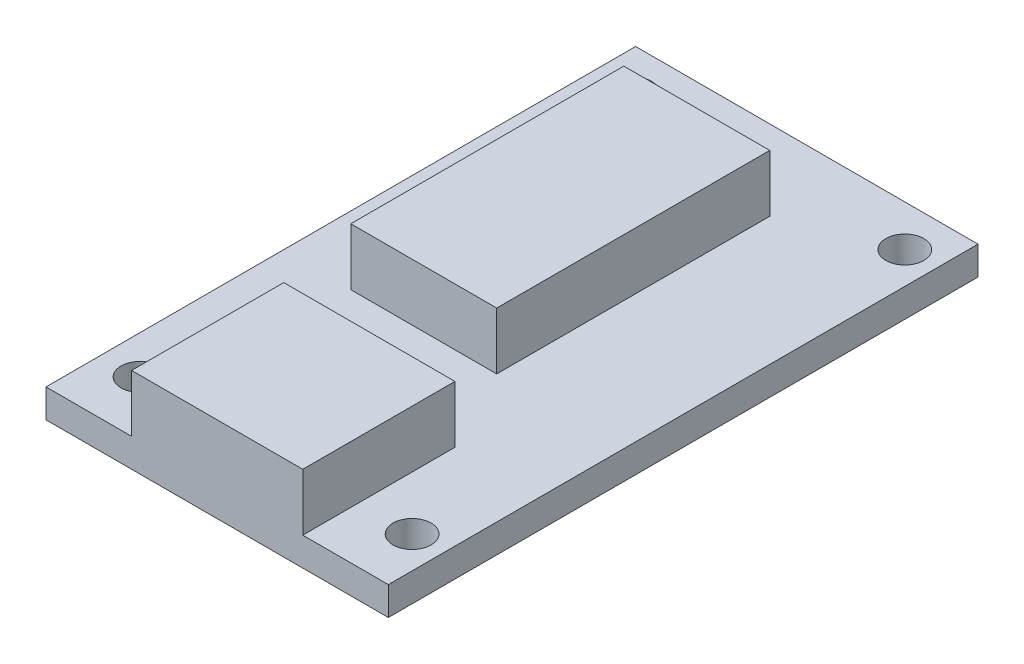
from build123d import *

# Parameters (mm, degrees)
SKETCH1_W           = 18
SKETCH1_H           = 31
BOSS_EXTRUDE1_DEPTH = 1.5
SKETCH1_3_W         = 9
SKETCH1_3_H         = 8
BOSS_EXTRUDE2_DEPTH = 4.5
SKETCH2_W           = 7.673510846
SKETCH2_H           = 14.355500628
BOSS_EXTRUDE3_DEPTH = 3
SKETCH3_R           = 1
CUT_EXTRUDE1_DEPTH  = 10


with BuildPart() as part:
    # Sketch1 → Boss-Extrude1 (new body)
    with BuildSketch(Plane(origin=(0, 0, 0), x_dir=(1, 0, 0), z_dir=(0, 1, 0))):
        with Locations((9, 15.5)):
            Rectangle(SKETCH1_W, SKETCH1_H)
    extrude(amount=BOSS_EXTRUDE1_DEPTH)

    # Sketch1<3> → Boss-Extrude2 (add)
    with BuildSketch(Plane(origin=(0, 0, 0), x_dir=(1, 0, 0), z_dir=(0, 1, 0))):
        with Locations((9, 4)):
            Rectangle(SKETCH1_3_W, SKETCH1_3_H)
    extrude(amount=BOSS_EXTRUDE2_DEPTH)

    # Sketch2 → Boss-Extrude3 (add)
    with BuildSketch(Plane(origin=(0, 1.5, 0), x_dir=(1, 0, 0), z_dir=(0, 1, 0))):
        with Locations((7.420466752, 19.616967898)):
            Rectangle(SKETCH2_W, SKETCH2_H)
    extrude(amount=BOSS_EXTRUDE3_DEPTH)

    # Sketch3 → Cut-Extrude1 (cut)
    with BuildSketch(Plane(origin=(0, 1.5, 0), x_dir=(1, 0, 0), z_dir=(0, 1, 0))):
        with Locations((2.017303644, 28.83251993)):
            Circle(SKETCH3_R)
        with Locations((16.320228506, 28.83251993)):
            Circle(SKETCH3_R)
        with Locations((2.017303644, 2.926927408)):
            Circle(SKETCH3_R)
        with Locations((16.320228506, 2.926927408)):
            Circle(SKETCH3_R)
    extrude(amount=-CUT_EXTRUDE1_DEPTH, mode=Mode.SUBTRACT)


solid = part.part
